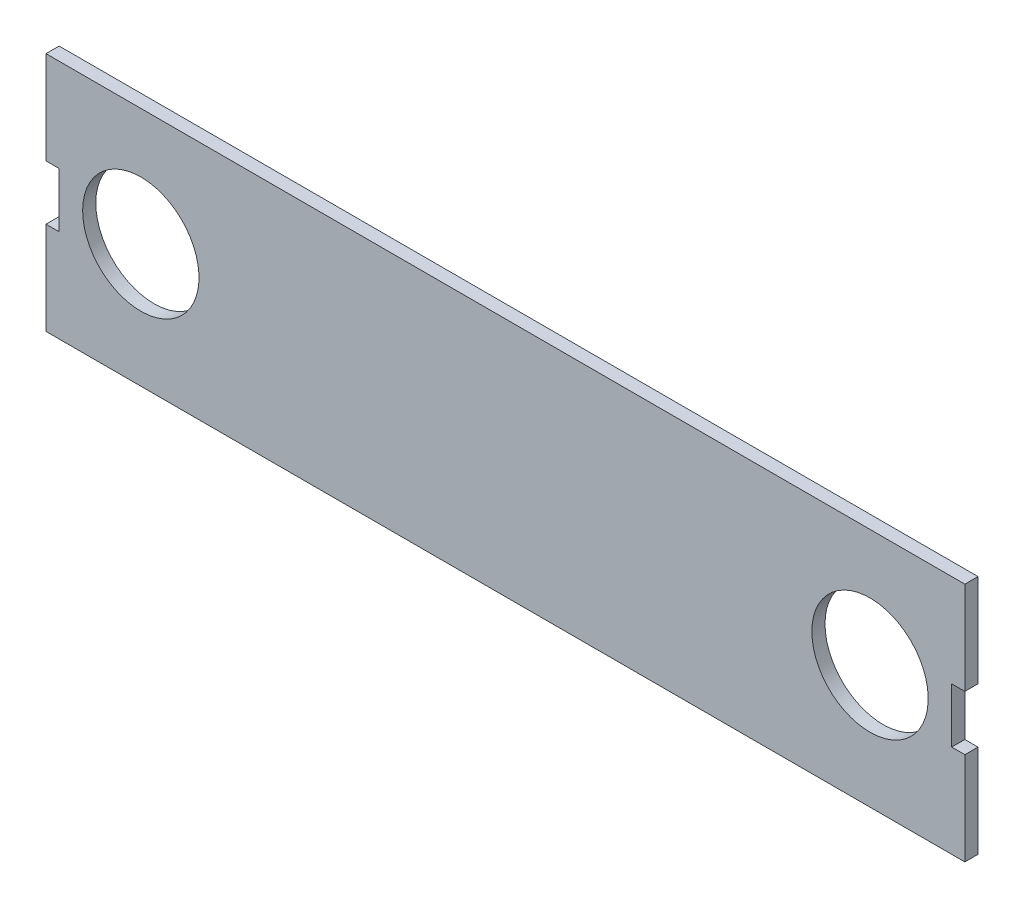
from build123d import *

# Parameters (mm, degrees)
SKETCH1_R           = 6.7437
BOSS_EXTRUDE1_DEPTH = 1.524


with BuildPart() as part:
    # Sketch1 → Boss-Extrude1 (new body)
    with BuildSketch(Plane.XY):
        Polygon((-1.524, -2.051280853), (0, -2.051280853), (0, -8.401280853), (-1.524, -8.401280853), (-1.524, -19.171774039), (104.993300406, -19.171774039), (104.993300406, -8.401280853), (103.469300406, -8.401280853), (103.469300406, -2.051280853), (104.993300406, -2.051280853), (104.993300406, 8.719212334), (-1.524, 8.719212334), align=None)
        with Locations((9.468478572, -4.905028475)):
            Circle(SKETCH1_R, mode=Mode.SUBTRACT)
        with Locations((94.000821834, -4.905028475)):
            Circle(SKETCH1_R, mode=Mode.SUBTRACT)
    extrude(amount=BOSS_EXTRUDE1_DEPTH)


solid = part.part
